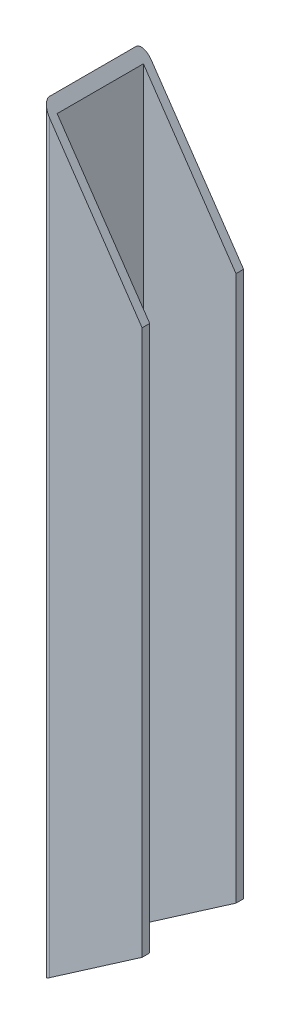
from build123d import *

# Parameters (mm, degrees)
SKETCH_1_W          = 74
SKETCH_1_H          = 34
EXTRUDE_1_DEPTH     = 300
SKETCH_2_W          = 41.646480438
SKETCH_2_H          = 42.526894273
CUT_EXTRUDE_1_DEPTH = 304.315017762
SKETCH_3_OUTSIDE_W  = 102.544
SKETCH_3_OUTSIDE_H  = 363.044
CUT_EXTRUDE_2_DEPTH = 306.286750449


with BuildPart() as part:
    # Эскиз1 → Вытянуть-Тонкостенный1 (new body)
    with BuildSketch(Plane(origin=(0, 0, 0), x_dir=(1, 0, 0), z_dir=(0, 1, 0))):
        with BuildLine():
            Line((40, 17), (40, -17))
            ThreePointArc((40, -17), (39.121320344, -19.121320344), (37, -20))
            Line((37, -20), (-37, -20))
            ThreePointArc((-37, -20), (-39.121320344, -19.121320344), (-40, -17))
            Line((-40, -17), (-40, 17))
            ThreePointArc((-40, 17), (-39.121320344, 19.121320344), (-37, 20))
            Line((-37, 20), (37, 20))
            ThreePointArc((37, 20), (39.121320344, 19.121320344), (40, 17))
        make_face()
        Rectangle(SKETCH_1_W, SKETCH_1_H, mode=Mode.SUBTRACT)
    extrude(amount=EXTRUDE_1_DEPTH)

    # Эскиз2 → Вырез-Вытянуть1 (cut, through all)
    with BuildSketch(Plane(origin=(0, 300, 0), x_dir=(1, 0, 0), z_dir=(0, 1, 0))):
        with Locations((20.323240219, -0.290673418)):
            Rectangle(SKETCH_2_W, SKETCH_2_H)
    extrude(amount=-CUT_EXTRUDE_1_DEPTH, mode=Mode.SUBTRACT)

    # Эскиз3 outside → Вырез-Вытянуть2 (cut, through all)
    with BuildSketch(Plane.XY.offset(20)):
        with Locations((-20.25, 150)):
            Rectangle(SKETCH_3_OUTSIDE_W, SKETCH_3_OUTSIDE_H)
        Polygon((-40, 300), (-0.5, 242.209429835), (-0.5, 27.271780287), (-40, 0), align=None, mode=Mode.SUBTRACT)
    extrude(amount=-CUT_EXTRUDE_2_DEPTH, mode=Mode.SUBTRACT)


solid = part.part
